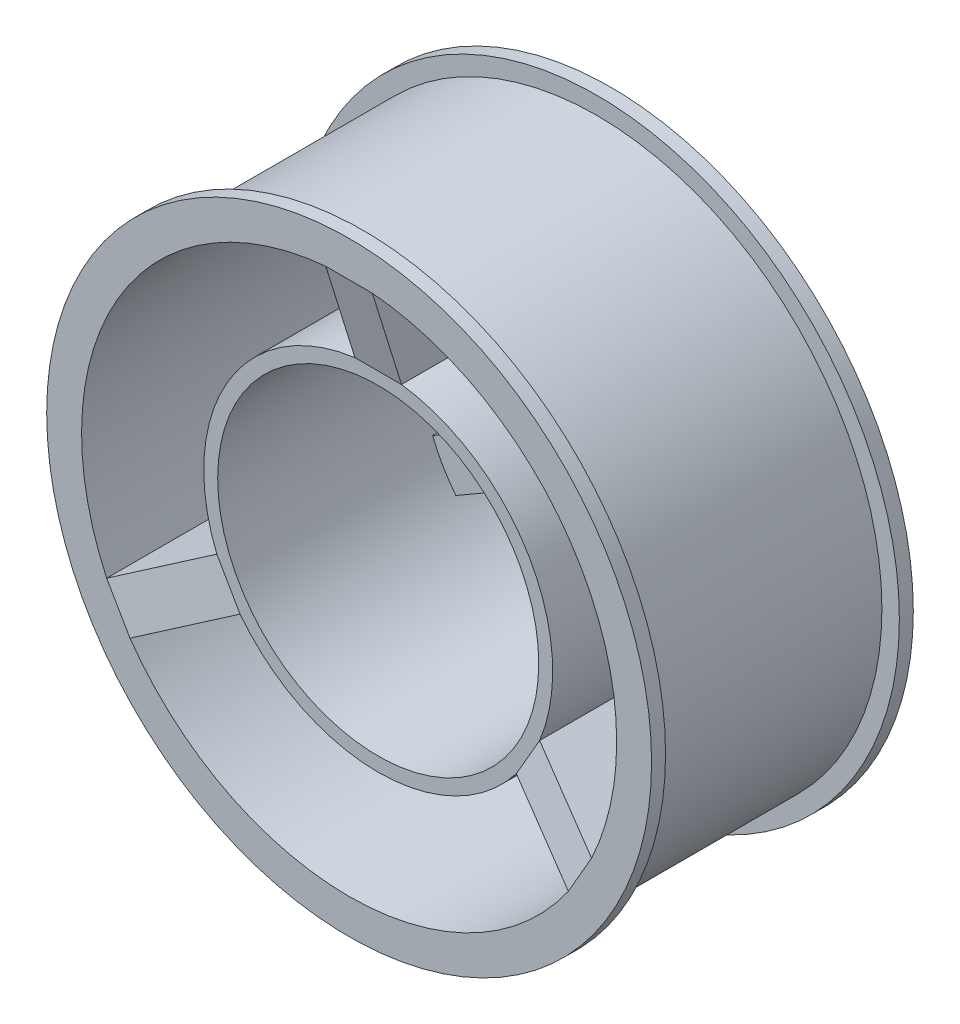
from build123d import *
from build123d.topology import SkipClean

# Parameters (mm, degrees)
BOSS_EXTRUDE1_DEPTH      = 22.5
BOSS_EXTRUDE1_DEPTH_BACK = 0.0001
SKETCH1_R                = 24.5
SKETCH1_R_2              = 23
SKETCH4_R                = 26
SKETCH4_R_2              = 23
BOSS_EXTRUDE2_DEPTH      = 1.2
BOSS_EXTRUDE4_START      = -1.2
SKETCH7_R                = 26
SKETCH7_R_2              = 24.253874055
BOSS_EXTRUDE4_DEPTH      = 1.2
SKETCH8_R                = 15
SKETCH8_R_2              = 13.8
BOSS_EXTRUDE5_DEPTH      = 20
SKETCH9_R                = 10
BOSS_EXTRUDE6_DEPTH      = 1
SKETCH11_W               = 4
SKETCH11_H               = 2.5
BOSS_EXTRUDE8_DEPTH      = 24
SKETCH19_W               = 4
SKETCH19_H               = 9.350394366
BOSS_EXTRUDE9_DEPTH      = 20
SKETCH13_R               = 4.65
CUT_EXTRUDE7_DEPTH       = 1.5
CIRPATTERN2_COUNT        = 3
SKETCH21_R               = 4.65
CUT_EXTRUDE8_DEPTH       = 1.5
CIRPATTERN6_COUNT        = 3
SKETCH23_R               = 1.1
CUT_EXTRUDE9_DEPTH       = 3.5
CIRPATTERN8_COUNT        = 3
CUT_EXTRUDE11_DEPTH      = 4
CIRPATTERN9_COUNT        = 3
BOSS_EXTRUDE10_START     = 4
SKETCH27_R               = 10
BOSS_EXTRUDE10_DEPTH     = 4
SKETCH29_R               = 6
BOSS_EXTRUDE11_DEPTH     = 4
CUT_EXTRUDE12_START      = -13
SKETCH30_R               = 1.1
CUT_EXTRUDE12_DEPTH      = 13
CUT_EXTRUDE13_START      = -13
SKETCH31_R               = 1.1
CUT_EXTRUDE13_DEPTH      = 13
SKETCH32_R               = 1.9
CUT_EXTRUDE14_DEPTH      = 7.5
CUT_EXTRUDE15_DEPTH      = 2.5
SKETCH36_R               = 1.6
CUT_EXTRUDE16_DEPTH      = 18.5
SKETCH40_R               = 7.25
BOSS_EXTRUDE13_DEPTH     = 0.5
SKETCH36_4_R             = 1.6
CUT_EXTRUDE17_DEPTH      = 8.5
SKETCH32_3_R             = 1.9
CUT_EXTRUDE18_DEPTH      = 4.5
CIRPATTERN10_COUNT       = 3


with BuildPart() as part:
    # Sketch1 → Boss-Extrude1 (new, two sides: drawn at the far end of the back side and taken through both)
    with BuildSketch(Plane.XY.offset(-BOSS_EXTRUDE1_DEPTH_BACK)):
        Circle(SKETCH1_R)
        Circle(SKETCH1_R_2, mode=Mode.SUBTRACT)
    extrude(amount=BOSS_EXTRUDE1_DEPTH + BOSS_EXTRUDE1_DEPTH_BACK)

    # Sketch4 → Boss-Extrude2 (add)
    with SkipClean():  # the faces are left unmerged after this step: merging them gives an invalid solid
        with BuildSketch(Plane.XY):
            Circle(SKETCH4_R)
            Circle(SKETCH4_R_2, mode=Mode.SUBTRACT)
        extrude(amount=BOSS_EXTRUDE2_DEPTH)

    # Sketch7 → Boss-Extrude4 (add)
    with SkipClean():  # the faces are left unmerged after this step: merging them gives an invalid solid
        with BuildSketch(Plane.XY.offset(22.5).offset(BOSS_EXTRUDE4_START)):
            Circle(SKETCH7_R)
            with Locations((-0.246125945, 0)):
                Circle(SKETCH7_R_2, mode=Mode.SUBTRACT)
        extrude(amount=BOSS_EXTRUDE4_DEPTH)



with BuildPart() as body_2:
    # Sketch8 → Boss-Extrude5 (new body)
    with BuildSketch(Plane.XY):
        Circle(SKETCH8_R)
        Circle(SKETCH8_R_2, mode=Mode.SUBTRACT)
    extrude(amount=BOSS_EXTRUDE5_DEPTH)


with BuildPart() as body_3:
    # Sketch9 → Boss-Extrude6 (new body)
    with BuildSketch(Plane.XY):
        Circle(SKETCH9_R)
    extrude(amount=BOSS_EXTRUDE6_DEPTH)


with BuildPart() as part_1:
    add(part.part)

    add(body_2.part)  # Boss-Extrude8 merges body 2

    add(body_3.part)  # Boss-Extrude8 merges body 3
    # Sketch11 → Boss-Extrude8 (add)
    with BuildSketch(Plane(origin=(0, 0, 0), x_dir=(1, 0, 0), z_dir=(0, 1, 0))):
        with Locations((0, -1.25)):
            Rectangle(SKETCH11_W, SKETCH11_H)
    boss_extrude8 = extrude(amount=BOSS_EXTRUDE8_DEPTH)

    # Sketch19 → Boss-Extrude9 (add, through all)
    with BuildSketch(Plane.XY.offset(2.5)):
        with Locations((0, 19.250315011)):
            Rectangle(SKETCH19_W, SKETCH19_H)
    boss_extrude9 = extrude(amount=BOSS_EXTRUDE9_DEPTH)

    # Sketch13 → Cut-Extrude7 (cut)
    with BuildSketch(Plane.XY.offset(2.5)):
        Circle(SKETCH13_R)
    extrude(amount=-CUT_EXTRUDE7_DEPTH, mode=Mode.SUBTRACT)

    # CirPattern2: Boss-Extrude8 ×3 about axis
    cirpattern2_axis = Axis((0, 0, 0), (0, 0, 1))
    for i in range(1, CIRPATTERN2_COUNT):
        add(boss_extrude8.rotate(cirpattern2_axis, i * 360 / CIRPATTERN2_COUNT))

    # Sketch21 → Cut-Extrude8 (cut)
    with BuildSketch(Plane.XY.offset(2.5)):
        Circle(SKETCH21_R)
    extrude(amount=-CUT_EXTRUDE8_DEPTH, mode=Mode.SUBTRACT)

    # CirPattern6: Boss-Extrude9 ×3 about axis
    cirpattern6_axis = Axis((0, 0, 0), (0, 0, 1))
    for i in range(1, CIRPATTERN6_COUNT):
        add(boss_extrude9.rotate(cirpattern6_axis, i * 360 / CIRPATTERN6_COUNT))

    # Sketch23 → Cut-Extrude9 (cut)
    with BuildSketch(Plane(origin=(0, 0, 0), x_dir=(-1, 0, 0), z_dir=(0, 0, -1))):
        with Locations((0, 6)):
            Circle(SKETCH23_R)
    cut_extrude9 = extrude(amount=-CUT_EXTRUDE9_DEPTH, mode=Mode.SUBTRACT)

    # CirPattern8: Cut-Extrude9 ×3 about axis
    cirpattern8_axis = Axis((0, 0, 0), (0, 0, 1))
    for i in range(1, CIRPATTERN8_COUNT):
        add(cut_extrude9.rotate(cirpattern8_axis, i * 360 / CIRPATTERN8_COUNT), mode=Mode.SUBTRACT)

    # Sketch20 → Cut-Extrude11 (cut)
    with BuildSketch(Plane.ZY.offset(2)):
        Polygon((20, 14.866068747), (22.5, 22.912878475), (22.5, 14.575117828), (20, 14.575117828), align=None)
    cut_extrude11 = extrude(amount=-CUT_EXTRUDE11_DEPTH, mode=Mode.SUBTRACT)

    # CirPattern9: Cut-Extrude11 ×3 about axis
    cirpattern9_axis = Axis((0, 0, 0), (0, 0, 1))
    for i in range(1, CIRPATTERN9_COUNT):
        add(cut_extrude11.rotate(cirpattern9_axis, i * 360 / CIRPATTERN9_COUNT), mode=Mode.SUBTRACT)

    # Sketch27 → Boss-Extrude10 (add)
    with BuildSketch(Plane(origin=(0, 0, 0), x_dir=(-1, 0, 0), z_dir=(0, 0, -1)).offset(BOSS_EXTRUDE10_START)):
        Circle(SKETCH27_R)
    extrude(amount=-BOSS_EXTRUDE10_DEPTH)

    # Sketch29 → Boss-Extrude11 (add)
    with BuildSketch(Plane(origin=(0, 0, -4), x_dir=(-1, 0, 0), z_dir=(0, 0, -1))):
        Circle(SKETCH29_R)
    extrude(amount=BOSS_EXTRUDE11_DEPTH)

    # Sketch30 → Cut-Extrude12 (cut)
    with BuildSketch(Plane.XY.offset(1).offset(CUT_EXTRUDE12_START)):
        with Locations(Location((0, 6, 0), (0, 0, 180))):
            Circle(SKETCH30_R)
    extrude(amount=CUT_EXTRUDE12_DEPTH, mode=Mode.SUBTRACT)

    # Sketch31 → Cut-Extrude13 (cut)
    with BuildSketch(Plane.XY.offset(1).offset(CUT_EXTRUDE13_START)):
        with Locations(Location((5.196152423, -3, 0), (0, 0, 180))):
            Circle(SKETCH31_R)
        with Locations(Location((-5.196152423, -3, 0), (0, 0, 180))):
            Circle(SKETCH31_R)
    extrude(amount=CUT_EXTRUDE13_DEPTH, mode=Mode.SUBTRACT)

    # Sketch32 → Cut-Extrude14 (cut)
    with SkipClean():  # the faces are left unmerged after this step: merging them gives an invalid solid
        with BuildSketch(Plane(origin=(0, 0, -8), x_dir=(-1, 0, 0), z_dir=(0, 0, -1))):
            with Locations((0, 6)):
                Circle(SKETCH32_R)
        cut_extrude14 = extrude(amount=-CUT_EXTRUDE14_DEPTH, mode=Mode.SUBTRACT)
    add(part_1.part.scale(1), mode=Mode.REPLACE)  # the faces are merged on a copy

    # Sketch35 → Cut-Extrude15 (cut)
    with BuildSketch(Plane.XY.offset(1)):
        Polygon((1.58771324, -2.75), (3.175426481, 0), (1.58771324, 2.75), (-1.58771324, 2.75), (-3.175426481, 0), (-1.58771324, -2.75), align=None)
    extrude(amount=-CUT_EXTRUDE15_DEPTH, mode=Mode.SUBTRACT)

    # Sketch36 → Cut-Extrude16 (cut)
    with BuildSketch(Plane(origin=(0, 0, -8), x_dir=(-1, 0, 0), z_dir=(0, 0, -1))):
        Circle(SKETCH36_R)
    extrude(amount=-CUT_EXTRUDE16_DEPTH, mode=Mode.SUBTRACT)

    # Sketch40 → Boss-Extrude13 (add)
    with BuildSketch(Plane(origin=(0, 0, -4), x_dir=(-1, 0, 0), z_dir=(0, 0, -1))):
        with Locations(Location((0, 0, 0), (0, 0, 102.455047825))):
            Circle(SKETCH40_R)
    extrude(amount=BOSS_EXTRUDE13_DEPTH)

    # Sketch36<4> → Cut-Extrude17 (cut)
    with BuildSketch(Plane(origin=(0, 0, -8), x_dir=(-1, 0, 0), z_dir=(0, 0, -1))):
        Circle(SKETCH36_4_R)
    extrude(amount=-CUT_EXTRUDE17_DEPTH, mode=Mode.SUBTRACT)

    # Sketch32<3> → Cut-Extrude18 (cut)
    with BuildSketch(Plane(origin=(0, 0, -8), x_dir=(-1, 0, 0), z_dir=(0, 0, -1))):
        with Locations((0, 6)):
            Circle(SKETCH32_3_R)
    extrude(amount=-CUT_EXTRUDE18_DEPTH, mode=Mode.SUBTRACT)

    # CirPattern10: Cut-Extrude14 ×3 about axis
    cirpattern10_axis = Axis((0, 0, 0), (0, 0, 1))
    for i in range(1, CIRPATTERN10_COUNT):
        add(cut_extrude14.rotate(cirpattern10_axis, i * 360 / CIRPATTERN10_COUNT), mode=Mode.SUBTRACT)


solid = part_1.part
